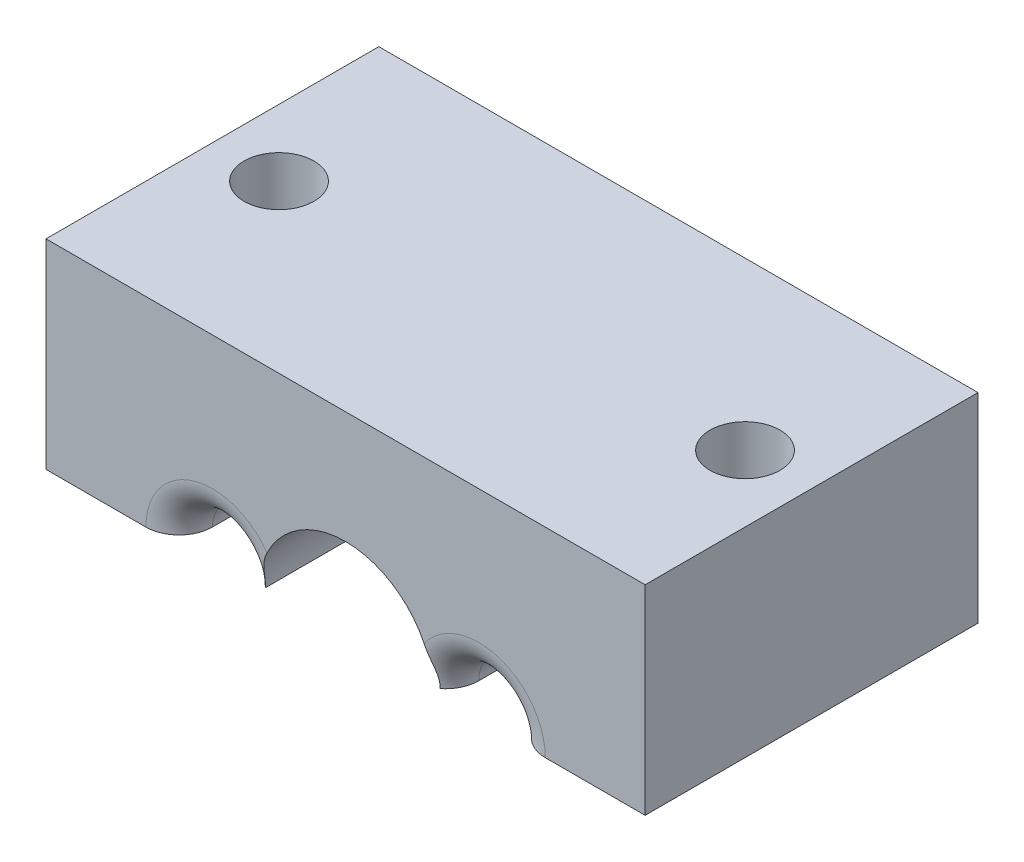
from build123d import *

# Parameters (mm, degrees)
BOSS_EXTRUDE1_DEPTH = 20
SKETCH2_W           = 0.8000000000000007
SKETCH2_H           = 0.7999999999999989
SKETCH2_H_2         = 0.8000000000000007
CHAMFER1_SIZE       = 0.4
FILLET2_R           = 2
SKETCH3_R           = 2.100000000000004
SKETCH3_R_2         = 2.100000000000001
CUT_EXTRUDE1_DEPTH  = 44.67007193971907


# Some blends are built 0.0001 mm under size
with BuildPart() as part:
    # Sketch1 → Boss-Extrude1 (new body)
    with BuildSketch(Plane.XY):
        with BuildLine():
            Line((0.9198479389646088, 14.89190109356241), (0.9198479389646088, 2.89190109356241))
            Line((0.9198479389646081, 2.89190109356241), (8.919847938964608, 2.89190109356241))
            ThreePointArc((8.919847938964608, 2.8919010935624105), (10.919847938964608, 4.89190109356241), (12.919847938964608, 2.89190109356241))
            Line((12.919847938964608, 2.89190109356241), (13.669847938964606, 2.89190109356241))
            ThreePointArc((13.669847938964608, 2.8919010935624114), (18.919847938964608, 8.14190109356241), (24.169847938964608, 2.89190109356241))
            Line((24.169847938964608, 2.89190109356241), (24.919847938964608, 2.89190109356241))
            ThreePointArc((24.919847938964608, 2.8919010935624105), (26.919847938964608, 4.891901093562406), (28.919847938964608, 2.89190109356241))
            Line((28.919847938964605, 2.89190109356241), (36.91984793896461, 2.89190109356241))
            Line((36.91984793896461, 2.89190109356241), (36.91984793896461, 14.89190109356241))
            Line((36.91984793896461, 14.89190109356241), (0.9198479389646088, 14.89190109356241))
        make_face()
    extrude(amount=BOSS_EXTRUDE1_DEPTH)

    # Sweep2: sweep along a curve in space
    with BuildLine() as sweep2_path:
        ThreePointArc((24.169847938964608, 2.89190109356241, 20), (22.632158540193984, 6.604211694791784, 20), (18.919847938964608, 8.141901093562412, 20))
        ThreePointArc((18.919847938964608, 8.141901093562412, 20), (15.207537337735232, 6.604211694791786, 20), (13.669847938964606, 2.89190109356241, 20))
    # Sketch2 → Sweep2 (sweep)
    with BuildSketch(Plane.XZ.offset(-2.89190109356241)):
        with Locations((14.069847938964607, 13.400000000000006)):
            Rectangle(SKETCH2_W, SKETCH2_H)
        with Locations((14.069847938964607, 10.400000000000004)):
            Rectangle(SKETCH2_W, SKETCH2_H_2)
        with Locations((14.069847938964607, 7.400000000000003)):
            Rectangle(SKETCH2_W, SKETCH2_H_2)
        Polygon((13.669847938964608, 4.8000000000000025), (14.469847938964607, 4.8000000000000025), (14.469847938964609, 4.000000000000002), (13.669847938964608, 4.000000000000002), align=None)
    sweep(path=sweep2_path.line)

    # Chamfer1
    chamfer1_edges = [part.edges().sort_by_distance(p)[0] for p in [
        (18.919847938964608, 7.341901093562408, 4.000000000000002),
        (18.919847938964608, 7.341901093562411, 4.8000000000000025),
        (18.919847938964608, 7.341901093562411, 7.0000000000000036),
        (18.919847938964608, 7.341901093562413, 7.800000000000004),
        (18.919847938964608, 7.341901093562413, 13.800000000000004),
        (18.919847938964608, 7.341901093562411, 13.000000000000005),
        (18.919847938964608, 7.341901093562413, 10.800000000000004),
        (18.919847938964608, 7.341901093562411, 10.000000000000004),
    ]]
    chamfer(chamfer1_edges, length=CHAMFER1_SIZE - 0.0001)  # a hair under: the kernel refuses the full size

    # Fillet2
    # the kernel refuses this fillet: 2 mm, written as the material it takes off along each edge
    with BuildSketch(Plane(origin=(10.919847938964608, 2.89190109356241, 0), x_dir=(-0.003141587485879782, -0.9999950652018582, 0), z_dir=(0.9999950652018582, -0.003141587485879782, 0))) as fillet2_piece_1:
        with BuildLine():
            CenterArc((2 + FILLET2_R, -FILLET2_R), FILLET2_R, 89.99999999999997, 90)
            Line((2 + FILLET2_R, 2.2e-16), (2, 0))
            Line((2, 0), (2, -FILLET2_R))
        make_face()
    revolve(axis=Axis((10.919847938964608, 2.89190109356241, 0), (0, 0, -1)), revolution_arc=359.64000000000004, mode=Mode.SUBTRACT)
    with BuildSketch(Plane(origin=(26.919847938964608, 2.8919010935624057, 0), x_dir=(-0.003141587485879782, -0.9999950652018582, 0), z_dir=(0.9999950652018582, -0.003141587485879782, 0))) as fillet2_piece_2:
        with BuildLine():
            CenterArc((2.000000000000005 + FILLET2_R, -FILLET2_R), FILLET2_R, 90, 90)
            Line((2.000000000000005, -FILLET2_R), (2.000000000000005, 0))
            Line((2.000000000000005, 0), (2.000000000000005 + FILLET2_R, 0))
        make_face()
    revolve(axis=Axis((26.919847938964608, 2.8919010935624057, 0), (0, 0, -1)), revolution_arc=359.64, mode=Mode.SUBTRACT)
    with BuildSketch(Plane(origin=(10.919847938964608, 2.89190109356241, 20), x_dir=(-0.003141587485879782, -0.9999950652018582, 0), z_dir=(0.9999950652018582, -0.003141587485879782, 0))) as fillet2_piece_3:
        with BuildLine():
            CenterArc((2.0000000000000058 + FILLET2_R, FILLET2_R), FILLET2_R, 180, 90)
            Line((2.0000000000000058, FILLET2_R), (2.0000000000000058, 0))
            Line((2.0000000000000058, 0), (2.0000000000000058 + FILLET2_R, 0))
        make_face()
    revolve(axis=Axis((10.919847938964608, 2.89190109356241, 20), (0, 0, -1)), revolution_arc=359.64000000000004, mode=Mode.SUBTRACT)
    with BuildSketch(Plane(origin=(26.919847938964608, 2.8919010935624057, 20), x_dir=(-0.003141587485879782, -0.9999950652018582, 0), z_dir=(0.9999950652018582, -0.003141587485879782, 0))) as fillet2_piece_4:
        with BuildLine():
            CenterArc((2.000000000000005 + FILLET2_R, FILLET2_R), FILLET2_R, 180, 90)
            Line((2.000000000000005, FILLET2_R), (2.000000000000005, 0))
            Line((2.000000000000005, 0), (2.000000000000005 + FILLET2_R, 0))
        make_face()
    revolve(axis=Axis((26.919847938964608, 2.8919010935624057, 20), (0, 0, -1)), revolution_arc=359.64, mode=Mode.SUBTRACT)

    # Sketch3 → Cut-Extrude1 (cut, through all)
    with BuildSketch(Plane.XZ.offset(-2.89190109356241)):
        with Locations(Location((32.9198479389646, 10, 0), (0, 0, 270))):
            Circle(SKETCH3_R)
        with Locations(Location((4.919847938964609, 10, 0), (0, 0, 270))):
            Circle(SKETCH3_R_2)
    extrude(amount=-CUT_EXTRUDE1_DEPTH, mode=Mode.SUBTRACT)


solid = part.part
